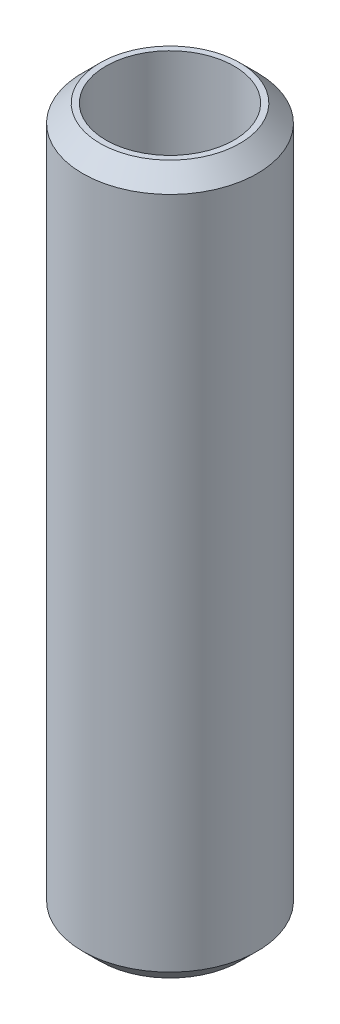
from build123d import *

# Parameters (mm, degrees)
SKETCH1_R           = 25
BOSS_EXTRUDE1_DEPTH = 202.788033825
SKETCH2_R           = 18.36052215
CUT_EXTRUDE1_DEPTH  = 206.846998187
CHAMFER1_SIZE       = 4.983200913


with BuildPart() as part:
    # Sketch1 → Boss-Extrude1 (new body)
    with BuildSketch(Plane(origin=(0, 0, 0), x_dir=(1, 0, 0), z_dir=(0, 1, 0))):
        Circle(SKETCH1_R)
    extrude(amount=BOSS_EXTRUDE1_DEPTH)

    # Sketch2 → Cut-Extrude1 (cut, through all)
    with BuildSketch(Plane(origin=(0, 0, 0), x_dir=(1, 0, 0), z_dir=(0, 1, 0))):
        Circle(SKETCH2_R)
    extrude(amount=CUT_EXTRUDE1_DEPTH, mode=Mode.SUBTRACT)

    # Chamfer1
    chamfer1_edges = [part.edges().sort_by_distance(p)[0] for p in [
        (-25, 202.788033825, 0),
        (-25, 0, 0),
    ]]
    chamfer(chamfer1_edges, length=CHAMFER1_SIZE)


solid = part.part
